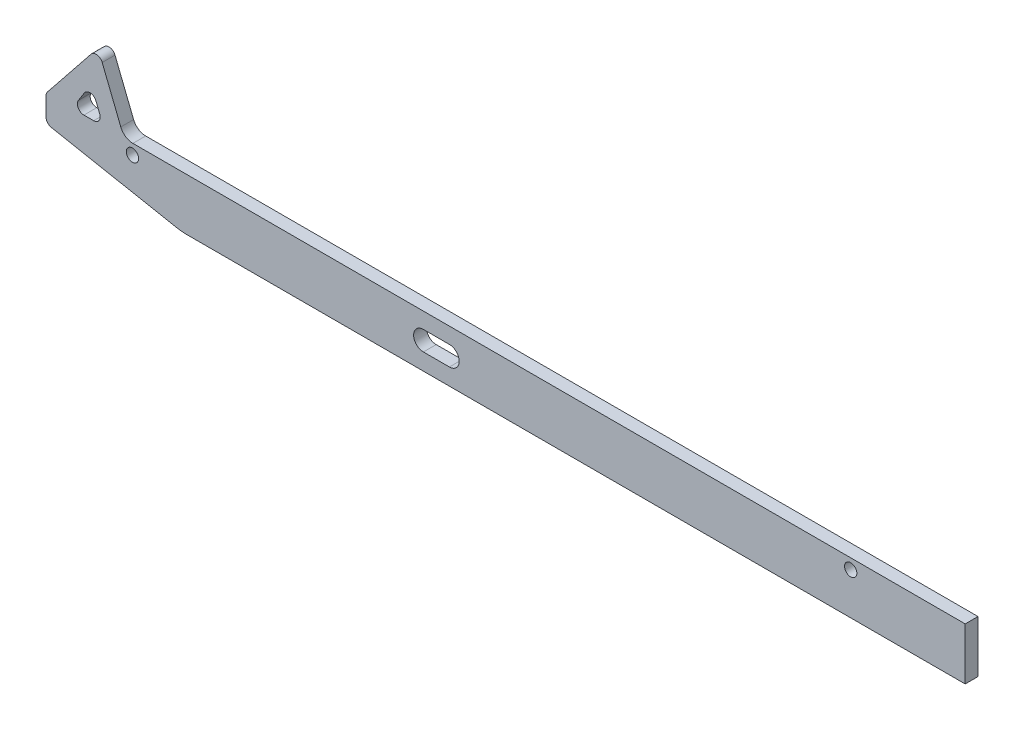
from build123d import *

# Parameters (mm, degrees)
BOSS_EXTRUDE1_DEPTH = 3.1242
FILLET4_R           = 12.7
FILLET8_R           = 1.5875
FILLET9_R           = 3.175
CUT_EXTRUDE1_DEPTH  = 116.691473387
SKETCH3_R           = 1.5
CUT_EXTRUDE2_DEPTH  = 116.691473387


with BuildPart() as part:
    # Sketch1 → Boss-Extrude1 (new body)
    with BuildSketch(Plane.XY):
        Polygon((113.799832915, -6.443650697), (-77.372532393, -6.443650697), (-110.491946085, -0.093650697), (-110.491946085, 6.256349303), (-97.791946085, 22.131349303), (-91.441946085, 6.256349303), (113.799832915, 6.256349303), align=None)
        Polygon((-104.141946085, 6.256349303), (-99.460780317, 13.603434884), (-96.521946085, 6.256349303), align=None, mode=Mode.SUBTRACT)
    extrude(amount=BOSS_EXTRUDE1_DEPTH)

    # Fillet4
    fillet4_edges = [part.edges().sort_by_distance(p)[0] for p in [
        (-77.372532393, -6.443650697, 1.5621),
    ]]
    fillet(fillet4_edges, radius=FILLET4_R)

    # Fillet8
    fillet8_edges = [part.edges().sort_by_distance(p)[0] for p in [
        (-110.491946085, -0.093650697, 1.5621),
        (-110.491946085, 6.256349303, 1.5621),
        (-97.791946085, 22.131349303, 1.5621),
        (-99.460780317, 13.603434884, 1.5621),
        (-104.141946085, 6.256349303, 1.5621),
        (-96.521946085, 6.256349303, 1.5621),
    ]]
    fillet(fillet8_edges, radius=FILLET8_R)

    # Fillet9
    fillet9_edges = [part.edges().sort_by_distance(p)[0] for p in [
        (-91.441946085, 6.256349303, 1.5621),
    ]]
    fillet(fillet9_edges, radius=FILLET9_R)

    # Sketch2 → Cut-Extrude1 (cut, through all)
    with BuildSketch(Plane.XY.offset(3.1242)):
        with BuildLine():
            Line((-18.407167085, 2.38125), (-12.057167085, 2.38125))
            ThreePointArc((-12.057167085, 2.38125), (-9.675917085, 0), (-12.057167085, -2.38125))
            Line((-12.057167085, -2.38125), (-18.407167085, -2.38125))
            ThreePointArc((-18.407167085, -2.38125), (-20.788417085, 0), (-18.407167085, 2.38125))
        make_face()
    extrude(amount=-CUT_EXTRUDE1_DEPTH, mode=Mode.SUBTRACT)

    # Sketch3 → Cut-Extrude2 (cut, through all)
    with BuildSketch(Plane.XY.offset(3.1242)):
        with Locations((85.859832915, 3.716349303)):
            Circle(SKETCH3_R)
        with Locations((-89.400167085, 3.716349303)):
            Circle(SKETCH3_R)
    extrude(amount=-CUT_EXTRUDE2_DEPTH, mode=Mode.SUBTRACT)


solid = part.part
